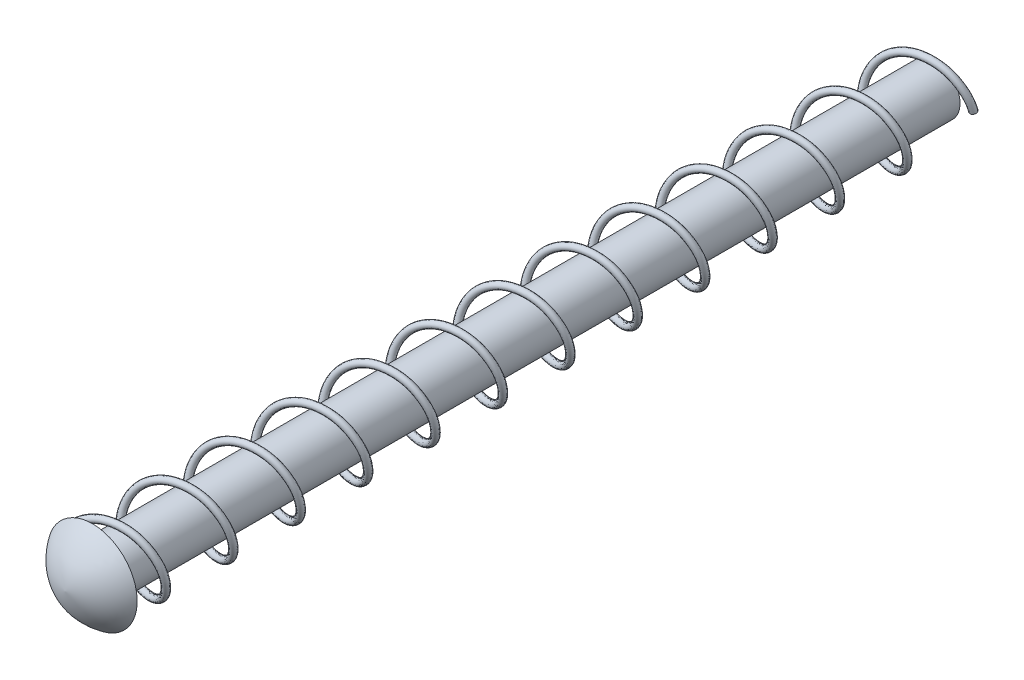
from build123d import *

# Parameters (mm, degrees)
SKETCH1_R           = 0.37
BOSS_EXTRUDE1_DEPTH = 12.5
SWEEP2_PITCH        = 1


with BuildPart() as part:
    # Sketch1 → Boss-Extrude1 (new body)
    with BuildSketch(Plane.XY):
        Circle(SKETCH1_R)
    extrude(amount=BOSS_EXTRUDE1_DEPTH)

    # Sketch3 → Revolve1 (revolve)
    with BuildSketch(Plane(origin=(0, 0, 0), x_dir=(0, 0, -1), z_dir=(1, 0, 0))):
        with BuildLine():
            Line((-12.5, 0.663769995), (-12.5, 0))
            Line((-12.5, 0), (-12.905872315, 0))
            ThreePointArc((-12.905872315, 0), (-12.777817745, 0.377672489), (-12.5, 0.663769995))
        make_face()
    revolve(axis=Axis((0, 0, 12.5), (0, 0, 1)))

    # Sweep2: the profile of Sweep2 profile screwed along a right-hand helix of 12.5 turns, 8 arcs to a turn; built about Z, then put on its axis
    sweep2_z = Axis((0, 0, 0), (0, 0, 1))
    sweep2_corners = [(0.567515849, -0.013501201, 0.048142679), (0.617515849, 0, 0), (0.567515849, 0.013501201, -0.048142679), (0.517515849, 0, 0)]
    with BuildLine(mode=Mode.PRIVATE) as sweep2_profile:
        ThreePointArc((0.567515849, -0.013501201, 0.048142679), (0.602871188, -0.009546791, 0.034042015), (0.617515849, 0, 0))
        ThreePointArc((0.617515849, 0, 0), (0.602871188, 0.009546791, -0.034042015), (0.567515849, 0.013501201, -0.048142679))
        ThreePointArc((0.567515849, 0.013501201, -0.048142679), (0.53216051, 0.009546791, -0.034042015), (0.517515849, 0, 0))
        ThreePointArc((0.517515849, 0, 0), (0.53216051, -0.009546791, 0.034042015), (0.567515849, -0.013501201, 0.048142679))
    sweep2_cap = Face(sweep2_profile.wire())
    sweep2_arcs = [((0.567515849, -0.013501201, 0.048142679), (0.617515849, -0.013501201, 0.048142679), (0.617515849, 0, 0), (1, 0.7071067811865475, 1)), ((0.617515849, 0, 0), (0.617515849, 0.013501201, -0.048142679), (0.567515849, 0.013501201, -0.048142679), (1, 0.7071067811865475, 1)), ((0.567515849, 0.013501201, -0.048142679), (0.517515849, 0.013501201, -0.048142679), (0.517515849, 0, 0), (1, 0.7071067811865475, 1)), ((0.517515849, 0, 0), (0.517515849, -0.013501201, 0.048142679), (0.567515849, -0.013501201, 0.048142679), (1, 0.7071067811865475, 1))]  # start, shoulder, end, weights
    sweep2_turn_angles = [0, 22.5, 45, 67.5, 90, 112.5, 135, 157.5, 180, 202.5, 225, 247.5, 270, 292.5, 315, 337.5, 360]
    sweep2_turn_weights = [1, 0.9238795325112867, 1, 0.9238795325112867, 1, 0.9238795325112867, 1, 0.9238795325112867, 1, 0.9238795325112867, 1, 0.9238795325112867, 1, 0.9238795325112867, 1, 0.9238795325112867, 1]
    sweep2_turn_sides = [Face.make_bezier_surface([[Vector(p[j][0], p[j][1], 0).rotate(sweep2_z, sweep2_turn_angles[2 * i + k]) / sweep2_turn_weights[2 * i + k] + Vector(0, 0, p[j][2] + SWEEP2_PITCH * sweep2_turn_angles[2 * i + k] / 360) for k in range(3)] for j in range(3)], [[p[3][j] * sweep2_turn_weights[2 * i + k] for k in range(3)] for j in range(3)]) for p in sweep2_arcs for i in range(8)]
    sweep2_last_angles = [4320, 4342.5, 4365, 4387.5, 4410, 4432.5, 4455, 4477.5, 4500]
    sweep2_last_weights = [1, 0.9238795325112867, 1, 0.9238795325112867, 1, 0.9238795325112867, 1, 0.9238795325112746, 1]
    sweep2_last_sides = [Face.make_bezier_surface([[Vector(p[j][0], p[j][1], 0).rotate(sweep2_z, sweep2_last_angles[2 * i + k]) / sweep2_last_weights[2 * i + k] + Vector(0, 0, p[j][2] + SWEEP2_PITCH * sweep2_last_angles[2 * i + k] / 360) for k in range(3)] for j in range(3)], [[p[3][j] * sweep2_last_weights[2 * i + k] for k in range(3)] for j in range(3)]) for p in sweep2_arcs for i in range(4)]
    sweep2 = Plane(origin=(0, 0, 0), x_dir=(1, 0, 0), z_dir=(0, 0, 1)) * Solid(Shell([*[p.moved(Location((0, 0, SWEEP2_PITCH * i))) for i in range(12) for p in sweep2_turn_sides], *sweep2_last_sides, sweep2_cap, sweep2_cap.rotate(sweep2_z, 4500).moved(Location((0, 0, SWEEP2_PITCH * 4500 / 360)))]))
    add(sweep2)


solid = part.part
